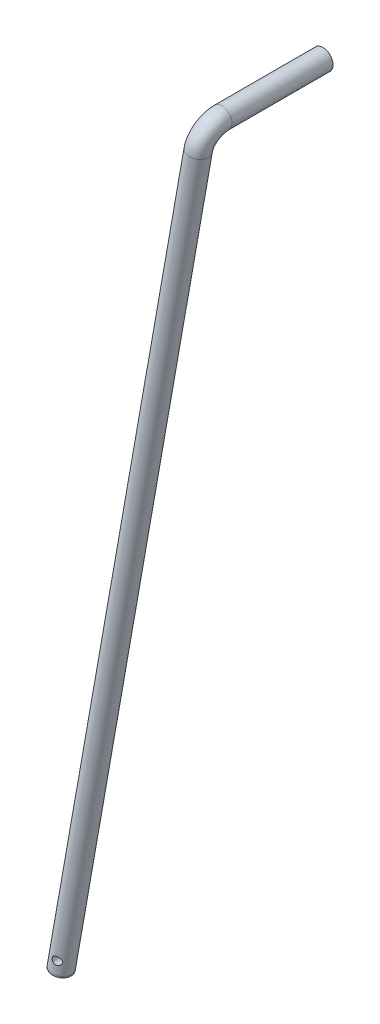
from build123d import *

# Parameters (mm, degrees)
SKETCH1_W                      = 100
SKETCH1_H                      = 120
BOSS_EXTRUDE1_DEPTH            = 10
SKETCH2_W                      = 100
SKETCH2_H                      = 10
BOSS_EXTRUDE2_DEPTH            = 20
SKETCH3_W                      = 100
SKETCH3_H                      = 10
BOSS_EXTRUDE3_DEPTH            = 50
SKETCH4_W                      = 100
SKETCH4_H                      = 10
BOSS_EXTRUDE4_DEPTH            = 10
SWEEP4_PROFILE_R               = 25
SKETCH16_W                     = 120
SKETCH16_H                     = 120
BOSS_EXTRUDE5_DEPTH            = 5
SKETCH23_W                     = 2.5
SKETCH23_H                     = 90
F_5_0MM_DOWEL_HOLE1_AT_2_COUNT = 2
F_5_0MM_DOWEL_HOLE1_AT_2_PITCH = 80
F_5_0MM_DOWEL_HOLE1_AT_3_COUNT = 2
F_5_0MM_DOWEL_HOLE1_AT_3_PITCH = 120.415945788
F_5_0MM_DOWEL_HOLE1_AT_4_COUNT = 2
F_5_0MM_DOWEL_HOLE1_AT_4_PITCH = 90
F_5_0MM_DOWEL_HOLE2_AT_2_COUNT = 2
F_5_0MM_DOWEL_HOLE2_AT_2_PITCH = 110
F_5_0MM_DOWEL_HOLE2_AT_3_COUNT = 2
F_5_0MM_DOWEL_HOLE2_AT_3_PITCH = 155.563491861
F_5_0MM_DOWEL_HOLE2_AT_4_COUNT = 2
F_5_0MM_DOWEL_HOLE2_AT_4_PITCH = 110
SKETCH31_W                     = 10
SKETCH31_H                     = 60
SPLIT1_OUTLINE_W               = 100
SPLIT1_OUTLINE_H               = 170
SPLIT1_OUTLINE_R               = 10
SPLIT1_OUTLINE_R_2             = 2.5
SPLIT1_DEPTH                   = 40
SPLIT2_START                   = -240
SPLIT2_OUTLINE_W               = 120
SPLIT2_OUTLINE_H               = 120
SPLIT2_OUTLINE_R               = 2.5
SPLIT2_DEPTH                   = 5


# Read off the part's stored shape, not the designer's step: Split1, Split2
with BuildPart() as part:
    # Sketch1 → Boss-Extrude1 (new body)
    with BuildSketch(Plane.XY):
        Rectangle(SKETCH1_W, SKETCH1_H)
    extrude(amount=BOSS_EXTRUDE1_DEPTH)

    # Sketch2 → Boss-Extrude2 (add)
    with BuildSketch(Plane.XY.offset(10)):
        with Locations((0, 55)):
            Rectangle(SKETCH2_W, SKETCH2_H)
    extrude(amount=BOSS_EXTRUDE2_DEPTH)



with BuildPart() as body_2:
    # Sketch3 → Boss-Extrude3 (new body)
    with BuildSketch(Plane(origin=(0, 60, 0), x_dir=(1, 0, 0), z_dir=(0, 1, 0))):
        with Locations((0, -35)):
            Rectangle(SKETCH3_W, SKETCH3_H)
    extrude(amount=BOSS_EXTRUDE3_DEPTH)


with BuildPart() as part_1:
    add(part.part)

    add(body_2.part)  # Boss-Extrude4 merges body 2
    # Sketch4 → Boss-Extrude4 (add)
    with BuildSketch(Plane.XZ.offset(-60)):
        with Locations((0, 35)):
            Rectangle(SKETCH4_W, SKETCH4_H)
    extrude(amount=BOSS_EXTRUDE4_DEPTH)

    # Sketch23 → Ø5.0mm Dowel Hole1 (revolve, cut)
    with BuildSketch(Plane(origin=(40, 40, 0), x_dir=(0, 1, 0), z_dir=(1, 0, 0))):
        with Locations((1.25, 45)):
            Rectangle(SKETCH23_W, SKETCH23_H)
    f_5_0mm_dowel_hole1 = revolve(axis=Axis((40, 40, -6.35), (0, 0, 1)), mode=Mode.SUBTRACT)

    # Ø5.0mm Dowel Hole1 at 2: Ø5.0mm Dowel Hole1 ×2
    with Locations(*[(-i * F_5_0MM_DOWEL_HOLE1_AT_2_PITCH, 0, 0) for i in range(1, F_5_0MM_DOWEL_HOLE1_AT_2_COUNT)]):
        add(f_5_0mm_dowel_hole1, mode=Mode.SUBTRACT)

    # Ø5.0mm Dowel Hole1 at 3: Ø5.0mm Dowel Hole1 ×2
    with Locations(*[Vector(-0.6643638388299199, -0.7474093186836597, 0) * (i * F_5_0MM_DOWEL_HOLE1_AT_3_PITCH) for i in range(1, F_5_0MM_DOWEL_HOLE1_AT_3_COUNT)]):
        add(f_5_0mm_dowel_hole1, mode=Mode.SUBTRACT)

    # Ø5.0mm Dowel Hole1 at 4: Ø5.0mm Dowel Hole1 ×2
    with Locations(*[(0, -i * F_5_0MM_DOWEL_HOLE1_AT_4_PITCH, 0) for i in range(1, F_5_0MM_DOWEL_HOLE1_AT_4_COUNT)]):
        add(f_5_0mm_dowel_hole1, mode=Mode.SUBTRACT)


with BuildPart() as body_2_2:
    # Sweep4: sweep along a path in Sketch7
    with BuildLine(Plane(origin=(-10.2606043, 1.809221376, 0), x_dir=(0, 0, 1), z_dir=(-0.9848077530122091, 0.17364817766692414, 0))) as sweep4_path:
        Line((-235, 2047.645393419), (15, 2047.645393419))
        ThreePointArc((15, 2047.645393419), (50.355339059, 2033.000732479), (65, 1997.645393419))
        Line((65, 1997.645393419), (65, 47.645393419))
        Line((65, 47.645393419), (65, 44.411276158))
    # Sweep4 profile (on start of the path) → Sweep4 (sweep)
    with BuildSketch(Plane(origin=(345.309286776, 2018.346280235, -235), x_dir=(0, 1, 0), z_dir=(0, 0, 1))):
        Circle(SWEEP4_PROFILE_R)
    sweep(path=sweep4_path.line)

    # Sketch16 → Boss-Extrude5 (add)
    with BuildSketch(Plane(origin=(0, 0, -235), x_dir=(-1, 0, 0), z_dir=(0, 0, -1))):
        with Locations((-345.309286776, 2018.346280235)):
            Rectangle(SKETCH16_W, SKETCH16_H)
    extrude(amount=BOSS_EXTRUDE5_DEPTH)

    # Sketch28 → Ø5.0mm Dowel Hole2 (revolve, cut)
    with BuildSketch(Plane(origin=(400.309286776, 2073.346280235, -240), x_dir=(0, 1, 0), z_dir=(1, 0, 0))):
        Polygon((0, 0), (0, 21.502151548), (2.5, 20), (2.5, 0), align=None)
    f_5_0mm_dowel_hole2 = revolve(axis=Axis((400.309286776, 2073.346280235, -246.35), (0, 0, 1)), mode=Mode.SUBTRACT)

    # Ø5.0mm Dowel Hole2 at 2: Ø5.0mm Dowel Hole2 ×2
    with Locations(*[(-i * F_5_0MM_DOWEL_HOLE2_AT_2_PITCH, 0, 0) for i in range(1, F_5_0MM_DOWEL_HOLE2_AT_2_COUNT)]):
        add(f_5_0mm_dowel_hole2, mode=Mode.SUBTRACT)

    # Ø5.0mm Dowel Hole2 at 3: Ø5.0mm Dowel Hole2 ×2
    with Locations(*[Vector(-0.7071067811865461, -0.707106781186549, 0) * (i * F_5_0MM_DOWEL_HOLE2_AT_3_PITCH) for i in range(1, F_5_0MM_DOWEL_HOLE2_AT_3_COUNT)]):
        add(f_5_0mm_dowel_hole2, mode=Mode.SUBTRACT)

    # Ø5.0mm Dowel Hole2 at 4: Ø5.0mm Dowel Hole2 ×2
    with Locations(*[(0, -i * F_5_0MM_DOWEL_HOLE2_AT_4_PITCH, 0) for i in range(1, F_5_0MM_DOWEL_HOLE2_AT_4_COUNT)]):
        add(f_5_0mm_dowel_hole2, mode=Mode.SUBTRACT)


with BuildPart() as f_20_0mm_dowel_hole1_tool:
    # Sketch31 → Ø20.0mm Dowel Hole1 (revolve)
    with BuildSketch(Plane(origin=(10, 80, 30), x_dir=(0, 1, 0), z_dir=(1, 0, 0))):
        with Locations((5, 30)):
            Rectangle(SKETCH31_W, SKETCH31_H)
    revolve(axis=Axis((10, 80, 23.65), (0, 0, 1)))


with BuildPart() as part_2:
    add(part_1.part)

    # Ø20.0mm Dowel Hole1: cut by f_20_0mm_dowel_hole1_tool
    add(f_20_0mm_dowel_hole1_tool.part, mode=Mode.SUBTRACT)

    # Split1 outline → Split1 (cut)
    with BuildSketch(Plane.XY):
        with Locations((0, 25)):
            Rectangle(SPLIT1_OUTLINE_W, SPLIT1_OUTLINE_H)
        with Locations((10, 80)):
            Circle(SPLIT1_OUTLINE_R, mode=Mode.SUBTRACT)
        with Locations((40, 40)):
            Circle(SPLIT1_OUTLINE_R_2, mode=Mode.SUBTRACT)
        with Locations((-40, -50)):
            Circle(SPLIT1_OUTLINE_R_2, mode=Mode.SUBTRACT)
        with Locations((40, -50)):
            Circle(SPLIT1_OUTLINE_R_2, mode=Mode.SUBTRACT)
        with Locations((-40, 40)):
            Circle(SPLIT1_OUTLINE_R_2, mode=Mode.SUBTRACT)
    extrude(amount=SPLIT1_DEPTH, mode=Mode.SUBTRACT)


with BuildPart() as body_2_2_1:
    add(body_2_2.part)

    # Ø20.0mm Dowel Hole1: cut by f_20_0mm_dowel_hole1_tool
    add(f_20_0mm_dowel_hole1_tool.part, mode=Mode.SUBTRACT)

    # Split2 outline → Split2 (cut)
    with BuildSketch(Plane.XY.offset(SPLIT2_START)):
        with Locations((345.309286776, 2018.346280235)):
            Rectangle(SPLIT2_OUTLINE_W, SPLIT2_OUTLINE_H)
        with Locations((290.309286776, 1963.346280235)):
            Circle(SPLIT2_OUTLINE_R, mode=Mode.SUBTRACT)
        with Locations((400.309286776, 1963.346280235)):
            Circle(SPLIT2_OUTLINE_R, mode=Mode.SUBTRACT)
        with Locations((290.309286776, 2073.346280235)):
            Circle(SPLIT2_OUTLINE_R, mode=Mode.SUBTRACT)
        with Locations((400.309286776, 2073.346280235)):
            Circle(SPLIT2_OUTLINE_R, mode=Mode.SUBTRACT)
    extrude(amount=SPLIT2_DEPTH, mode=Mode.SUBTRACT)


solid = body_2_2_1.part
